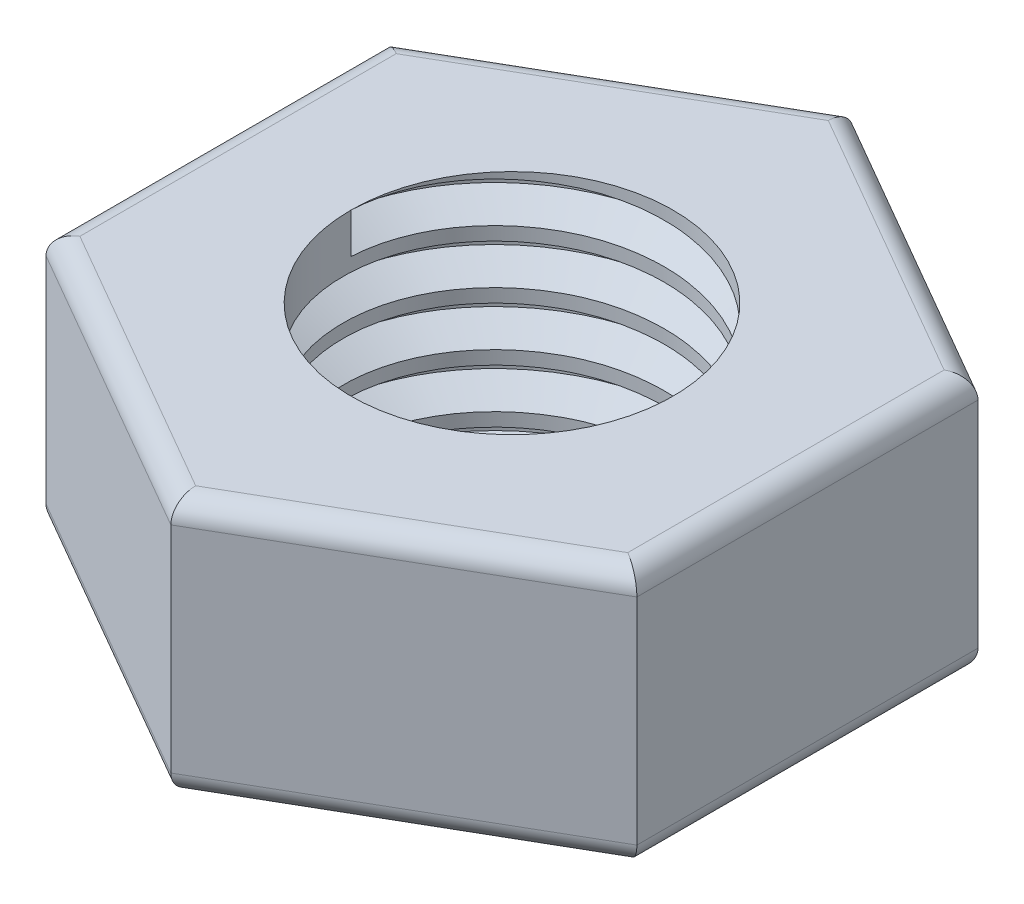
from build123d import *

# Parameters (mm, degrees)
SKETCH1_R           = 1.5
BOSS_EXTRUDE1_DEPTH = 2.4
THREAD1_PITCH       = 0.5
FILLET1_R           = 0.2


with BuildPart() as part:
    # Sketch1 → Boss-Extrude1 (new body)
    with BuildSketch(Plane(origin=(0, 0, 0), x_dir=(1, 0, 0), z_dir=(0, 1, 0))):
        Polygon((0, 3.175426481), (-2.75, 1.58771324), (-2.75, -1.58771324), (0, -3.175426481), (2.75, -1.58771324), (2.75, 1.58771324), align=None)
        with Locations(Location((0, 0, 0), (0, 0, 270))):
            Circle(SKETCH1_R, mode=Mode.SUBTRACT)
    extrude(amount=BOSS_EXTRUDE1_DEPTH)

    # Thread1: the profile of Thread Profile1 profile screwed along a right-hand helix of 4.8 turns, 6 arcs to a turn; built about Z, then put on its axis
    thread1_z = Axis((0, 0, 0), (0, 0, 1))
    thread1_corners = [(1.4997, 0, -0.000173205), (1.770632938, 0, 0.156249999), (1.770632938, 0, 0.218749999), (1.4997, 0, 0.375173204)]
    with BuildLine(mode=Mode.PRIVATE) as thread1_profile:
        Line(thread1_corners[0], thread1_corners[1])
        Line(thread1_corners[1], thread1_corners[2])
        Line(thread1_corners[2], thread1_corners[3])
        Line(thread1_corners[3], thread1_corners[0])
    thread1_cap = Face(thread1_profile.wire())
    thread1_turn_angles = [0, 30, 60, 90, 120, 150, 180, 210, 240, 270, 300, 330, 360]
    thread1_turn_weights = [1, 0.8660254037844387, 1, 0.8660254037844387, 1, 0.8660254037844387, 1, 0.8660254037844387, 1, 0.8660254037844387, 1, 0.8660254037844387, 1]
    thread1_turn_rails = [Edge.make_bspline([Vector(p[0], p[1], 0).rotate(thread1_z, thread1_turn_angles[k]) / thread1_turn_weights[k] + Vector(0, 0, p[2] + THREAD1_PITCH * thread1_turn_angles[k] / 360) for k in range(13)], [0, 0, 0, 1, 1, 2, 2, 3, 3, 4, 4, 5, 5, 6, 6, 6], 2, thread1_turn_weights) for p in thread1_corners]
    thread1_turn_sides = [Face.make_surface_from_curves(thread1_turn_rails[p[0]], thread1_turn_rails[p[1]]) for p in [(0, 1), (1, 2), (2, 3), (3, 0)]]
    thread1_last_angles = [1440, 1470, 1500, 1530, 1560, 1590, 1620, 1650, 1680, 1704, 1728]
    thread1_last_weights = [1, 0.8660254037844387, 1, 0.8660254037844387, 1, 0.8660254037844387, 1, 0.8660254037844387, 1, 0.9135454576426009, 1]
    thread1_last_rails = [Edge.make_bspline([Vector(p[0], p[1], 0).rotate(thread1_z, thread1_last_angles[k]) / thread1_last_weights[k] + Vector(0, 0, p[2] + THREAD1_PITCH * thread1_last_angles[k] / 360) for k in range(11)], [0, 0, 0, 1, 1, 2, 2, 3, 3, 4, 4, 5, 5, 5], 2, thread1_last_weights) for p in thread1_corners]
    thread1_last_sides = [Face.make_surface_from_curves(thread1_last_rails[p[0]], thread1_last_rails[p[1]]) for p in [(0, 1), (1, 2), (2, 3), (3, 0)]]
    thread1 = Plane(origin=(0, 2.4, 0), x_dir=(-1, 0, 0), z_dir=(0, -1, 0)) * Solid(Shell([*[p.moved(Location((0, 0, THREAD1_PITCH * i))) for i in range(4) for p in thread1_turn_sides], *thread1_last_sides, thread1_cap, thread1_cap.rotate(thread1_z, 1728).moved(Location((0, 0, THREAD1_PITCH * 1728 / 360)))]))
    add(thread1, mode=Mode.SUBTRACT)

    # Fillet1
    fillet1_edges = [part.edges().sort_by_distance(p)[0] for p in [
        (-2.75, 2.4, 0),
        (-1.375, 2.4, 2.38156986),
        (1.375, 2.4, 2.38156986),
        (2.75, 2.4, 0),
        (1.375, 2.4, -2.38156986),
        (2.75, 0, 0),
        (1.375, 0, 2.38156986),
        (-1.375, 0, 2.38156986),
        (-2.75, 0, 0),
        (-1.375, 0, -2.38156986),
        (1.375, 0, -2.38156986),
        (-1.375, 2.4, -2.38156986),
    ]]
    fillet(fillet1_edges, radius=FILLET1_R)


solid = part.part
